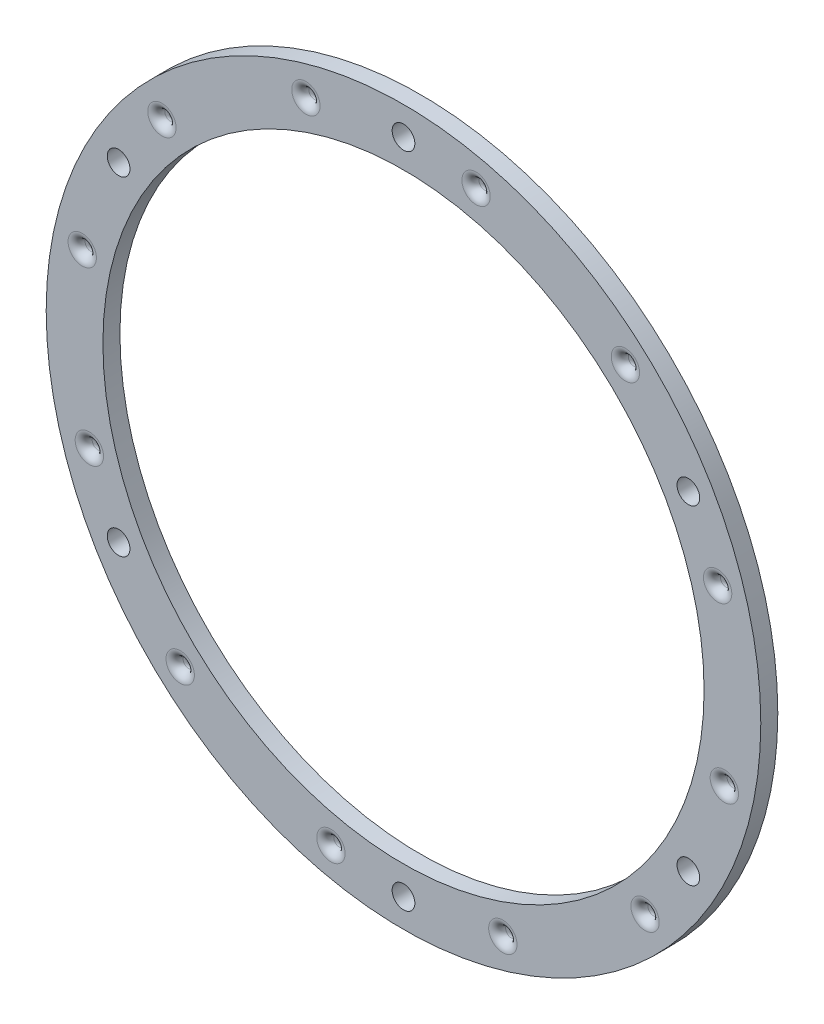
from build123d import *

# Parameters (mm, degrees)
SKETCH_1_R      = 63
SKETCH_1_R_2    = 2
SKETCH_1_R_3    = 53
SKETCH_1_R_4    = 1
EXTRUDE_1_DEPTH = 3
FILLET_1_R      = 1.5


with BuildPart() as part:
    # 草图1 → 凸台-拉伸1 (new body)
    with BuildSketch(Plane.XY):
        Circle(SKETCH_1_R)
        with Locations((0, 58)):
            Circle(SKETCH_1_R_2, mode=Mode.SUBTRACT)
        Circle(SKETCH_1_R_3, mode=Mode.SUBTRACT)
        with Locations((50.229473419, 29)):
            Circle(SKETCH_1_R_2, mode=Mode.SUBTRACT)
        with Locations((50.229473419, -29)):
            Circle(SKETCH_1_R_2, mode=Mode.SUBTRACT)
        with Locations((0, -58)):
            Circle(SKETCH_1_R_2, mode=Mode.SUBTRACT)
        with Locations((-50.229473419, -29)):
            Circle(SKETCH_1_R_2, mode=Mode.SUBTRACT)
        with Locations((-50.229473419, 29)):
            Circle(SKETCH_1_R_2, mode=Mode.SUBTRACT)
        with Locations((55.389887154, 17.203499674)):
            Circle(SKETCH_1_R_4, mode=Mode.SUBTRACT)
        with Locations((56.570799225, -12.796275826)):
            Circle(SKETCH_1_R_4, mode=Mode.SUBTRACT)
        with Locations((12.796275826, 56.570799225)):
            Circle(SKETCH_1_R_4, mode=Mode.SUBTRACT)
        with Locations((39.127932346, 42.813606603)):
            Circle(SKETCH_1_R_4, mode=Mode.SUBTRACT)
        with Locations((-39.367299552, -42.593611329)):
            Circle(SKETCH_1_R_4, mode=Mode.SUBTRACT)
        with Locations((-12.796275826, -56.570799225)):
            Circle(SKETCH_1_R_4, mode=Mode.SUBTRACT)
        with Locations((17.513704773, -55.29258671)):
            Circle(SKETCH_1_R_4, mode=Mode.SUBTRACT)
        with Locations((42.593611328, -39.367299552)):
            Circle(SKETCH_1_R_4, mode=Mode.SUBTRACT)
        with Locations((-17.203499674, 55.389887154)):
            Circle(SKETCH_1_R_4, mode=Mode.SUBTRACT)
        with Locations((-42.593611329, 39.367299552)):
            Circle(SKETCH_1_R_4, mode=Mode.SUBTRACT)
        with Locations((-56.641637119, 12.478980108)):
            Circle(SKETCH_1_R_4, mode=Mode.SUBTRACT)
        with Locations((-55.389887154, -17.203499674)):
            Circle(SKETCH_1_R_4, mode=Mode.SUBTRACT)
    extrude(amount=EXTRUDE_1_DEPTH)

    # 圆角1
    fillet_1_edges = [part.edges().sort_by_distance(p)[0] for p in [
        (54.389887154, 17.203499674, 0),
        (54.389887154, 17.203499674, 3),
        (55.570799225, -12.796275826, 0),
        (55.570799225, -12.796275826, 3),
        (-13.796275826, -56.570799225, 0),
        (-13.796275826, -56.570799225, 3),
        (-40.367299552, -42.593611329, 0),
        (-40.367299552, -42.593611329, 3),
        (11.796275826, 56.570799225, 0),
        (11.796275826, 56.570799225, 3),
        (38.127932346, 42.813606603, 0),
        (38.127932346, 42.813606603, 3),
        (41.593611328, -39.367299552, 0),
        (41.593611328, -39.367299552, 3),
        (16.513704773, -55.29258671, 0),
        (16.513704773, -55.29258671, 3),
        (-43.593611329, 39.367299552, 0),
        (-43.593611329, 39.367299552, 3),
        (-18.203499674, 55.389887154, 0),
        (-18.203499674, 55.389887154, 3),
        (-56.389887154, -17.203499674, 0),
        (-56.389887154, -17.203499674, 3),
        (-57.641637119, 12.478980108, 0),
        (-57.641637119, 12.478980108, 3),
    ]]
    fillet(fillet_1_edges, radius=FILLET_1_R - 0.0001)  # a hair under: the kernel refuses the full size


solid = part.part
